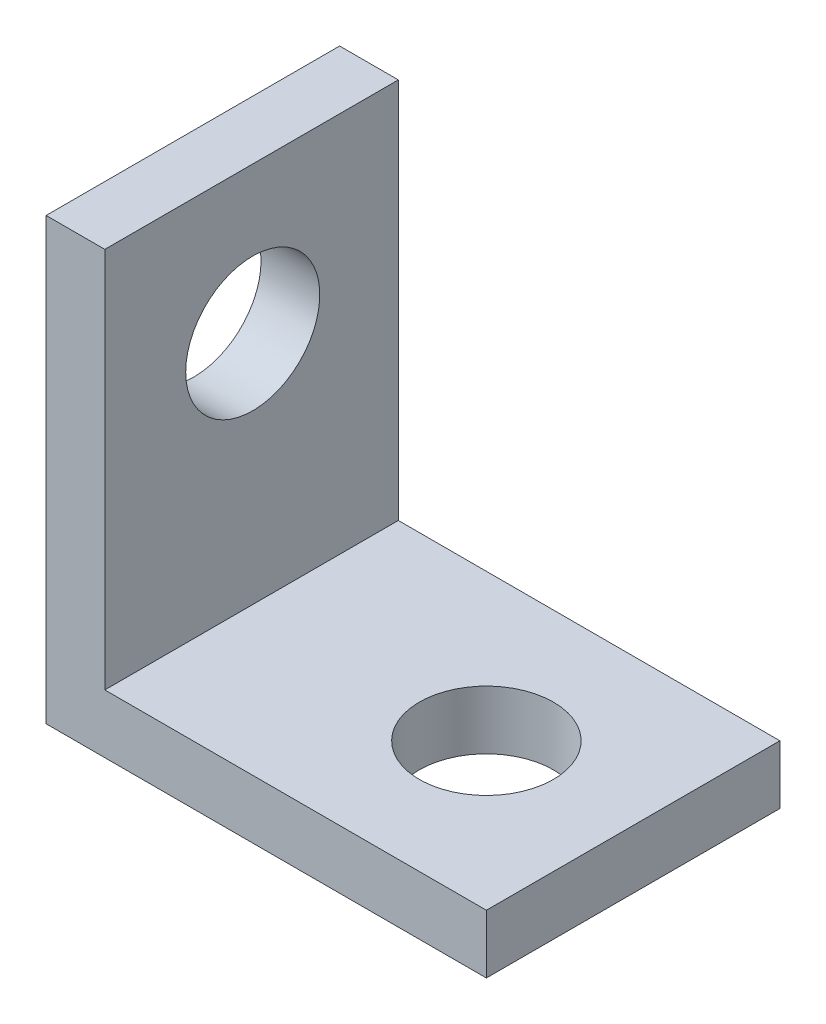
from build123d import *

# Parameters (mm, degrees)
BOSS_EXTRUDE1_DEPTH = 12.7
SKETCH2_R           = 2.9
CUT_EXTRUDE1_DEPTH  = 12.7
SKETCH3_R           = 2.9
CUT_EXTRUDE3_DEPTH  = 12.7


with BuildPart() as part:
    # Sketch1 → Boss-Extrude1 (new body)
    with BuildSketch(Plane.XY):
        Polygon((0, 0), (0, 19.05), (2.54, 19.05), (2.54, 2.54), (19.05, 2.54), (19.05, 0), align=None)
    extrude(amount=BOSS_EXTRUDE1_DEPTH)

    # Sketch2 → Cut-Extrude1 (cut)
    with BuildSketch(Plane(origin=(0, 0, 0), x_dir=(0, 0, -1), z_dir=(1, 0, 0))):
        with Locations((-6.299909987, 12.7)):
            Circle(SKETCH2_R)
    extrude(amount=CUT_EXTRUDE1_DEPTH, mode=Mode.SUBTRACT)

    # Sketch3 → Cut-Extrude3 (cut)
    with BuildSketch(Plane(origin=(0, 0, 0), x_dir=(1, 0, 0), z_dir=(0, 1, 0))):
        with Locations((12.7, -6.35)):
            Circle(SKETCH3_R)
    extrude(amount=CUT_EXTRUDE3_DEPTH, mode=Mode.SUBTRACT)


solid = part.part
